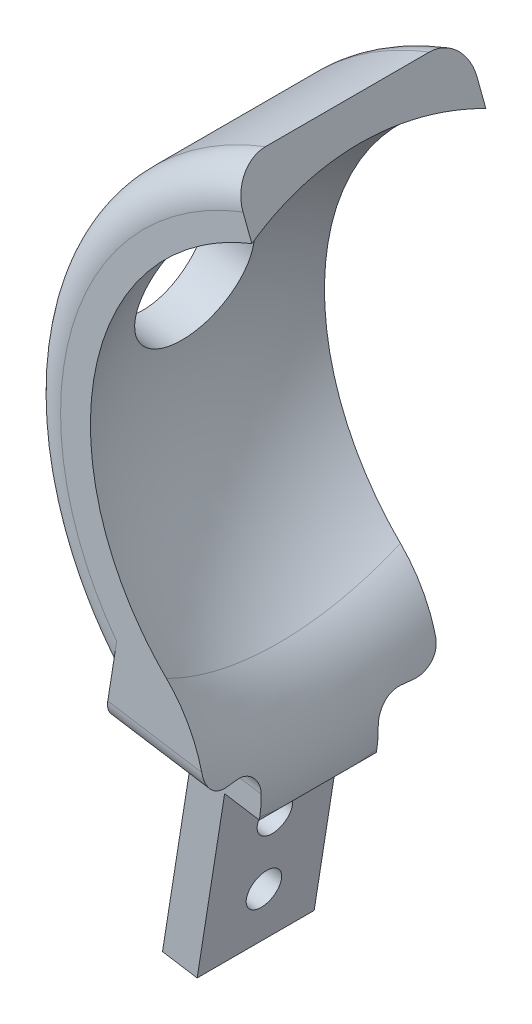
from build123d import *

# Parameters (mm, degrees)
SKETCH_1_R               = 13.75
EXTRUDE_1_DEPTH          = 10
CUT_EXTRUDE_1_DEPTH      = 22.866069606
PATTERN_CIRCULAR_1_COUNT = 20
EXTRUDE_2_DEPTH          = 5
EXTRUDE_2_DEPTH_BACK     = 15
CUT_EXTRUDE_3_DEPTH      = 10
CUT_EXTRUDE_3_DEPTH_BACK = 32
SKETCH_7_W               = 5
SKETCH_7_H               = 34
CUT_EXTRUDE_START        = -22
CUT_EXTRUDE_4_DEPTH      = 22
FILLET_2_R               = 2
FILLET_3_R               = 3
SKETCH_16_R              = 2
CUT_EXTRUDE_5_DEPTH      = 16.5
EXTRUDE_START            = 3.5
SKETCH_18_R              = 5
SKETCH_18_R_2            = 2
EXTRUDE_4_DEPTH          = 3.5
SKETCH_19_R              = 8
CUT_EXTRUDE_7_DEPTH      = 3
FILLET_4_R               = 2
CUT_EXTRUDE_8_DEPTH      = 10
CUT_EXTRUDE_9_DEPTH      = 22
SKETCH_22_R              = 1.5
CUT_EXTRUDE_10_DEPTH     = 22
SKETCH_24_R              = 5
CUT_EXTRUDE_11_DEPTH     = 26
FILLET_5_R               = 10


with BuildPart() as part:
    # 草图1 → 凸台-拉伸1 (new body)
    with BuildSketch(Plane.XY):
        Circle(SKETCH_1_R)
    extrude(amount=EXTRUDE_1_DEPTH)

    # 草图2 → 切除-拉伸1 (cut, through all)
    with BuildSketch(Plane.XY):
        with BuildLine():
            ThreePointArc((0.241645751, 10.934830295), (0, 10.9375), (-0.241645751, 10.934830295))
            add(Edge.make_bspline(
                [(-0.241645751, 10.934830295), (-0.763986756, 11.11684439), (-0.696355124, 11.483892124), (-0.766121321, 11.837511753), (-0.773615233, 11.871945767), (-0.782888612, 11.910793269), (-0.794115121, 11.953996045), (-0.807473925, 12.001489371), (-0.823140069, 12.053203535), (-0.841287339, 12.109063416), (-0.862087187, 12.168988684), (-0.885708875, 12.232893806), (-0.912319248, 12.300688126), (-0.942082628, 12.372275913), (-0.975160664, 12.447556439), (-1.011712206, 12.526424039), (-1.051893167, 12.608768189), (-1.095856396, 12.694473577), (-1.143751548, 12.783420187), (-1.195724957, 12.87548338), (-1.251919512, 12.970533976), (-1.312474533, 13.068438347), (-1.377525652, 13.169058507), (-1.447204695, 13.272252205), (-1.521639564, 13.377873025), (-1.600954126, 13.485770488), (-1.685268101, 13.595790151), (-1.774696952, 13.707773716), (-1.869351783, 13.821559139), (-1.969339231, 13.936980743), (-2.074761371, 14.053869328), (-2.185715611, 14.172052294), (-2.302294605, 14.291353753), (-2.424586158, 14.411594659), (-2.552673133, 14.532592924), (-2.686633373, 14.654163553), (-2.826539612, 14.776118764), (-2.972459398, 14.898268124), (-3.124455015, 15.020418683), (-3.282583418, 15.142375102), (-3.446896124, 15.2639398), (-3.676841988, 15.427049835), (-3.854915516, 15.545415751), (-3.976447477, 15.622814825)],
                knots=[0, 0, 0, 0, 0.165916003, 0.170905922, 0.176663519, 0.183188797, 0.190481754, 0.198542391, 0.207370708, 0.216966704, 0.22733038, 0.238461736, 0.250360771, 0.263027487, 0.276461881, 0.290663956, 0.30563371, 0.321371144, 0.337876258, 0.355149051, 0.373189524, 0.391997677, 0.411573509, 0.431917021, 0.453028213, 0.474907084, 0.497553636, 0.520967867, 0.545149777, 0.570099367, 0.595816637, 0.622301587, 0.649554216, 0.677574526, 0.706362514, 0.735918183, 0.766241531, 0.797332559, 0.829191267, 0.861817654, 0.895211721, 0.929373468, 1, 1, 1, 1], degree=3))
            ThreePointArc((-3.976447477, 15.622814825), (0, 16.120932901), (3.976447477, 15.622814825))
            add(Edge.make_bspline(
                [(0.241645751, 10.934830295), (0.763986756, 11.11684439), (0.696355124, 11.483892124), (0.766121321, 11.837511753), (0.773615233, 11.871945767), (0.782888612, 11.910793269), (0.794115121, 11.953996045), (0.807473925, 12.001489371), (0.823140069, 12.053203535), (0.841287339, 12.109063416), (0.862087187, 12.168988684), (0.885708875, 12.232893806), (0.912319248, 12.300688126), (0.942082628, 12.372275913), (0.975160664, 12.447556439), (1.011712206, 12.526424039), (1.051893167, 12.608768189), (1.095856396, 12.694473577), (1.143751548, 12.783420187), (1.195724957, 12.87548338), (1.251919512, 12.970533976), (1.312474533, 13.068438347), (1.377525652, 13.169058507), (1.447204695, 13.272252205), (1.521639564, 13.377873025), (1.600954126, 13.485770488), (1.685268101, 13.595790151), (1.774696952, 13.707773716), (1.869351783, 13.821559139), (1.969339231, 13.936980743), (2.074761371, 14.053869328), (2.185715611, 14.172052294), (2.302294605, 14.291353753), (2.424586158, 14.411594659), (2.552673133, 14.532592924), (2.686633373, 14.654163553), (2.826539612, 14.776118764), (2.972459398, 14.898268124), (3.124455015, 15.020418683), (3.282583418, 15.142375102), (3.446896124, 15.2639398), (3.676841988, 15.427049835), (3.854915516, 15.545415751), (3.976447477, 15.622814825)],
                knots=[0, 0, 0, 0, 0.165916003, 0.170905922, 0.176663519, 0.183188797, 0.190481754, 0.198542391, 0.207370708, 0.216966704, 0.22733038, 0.238461736, 0.250360771, 0.263027487, 0.276461881, 0.290663956, 0.30563371, 0.321371144, 0.337876258, 0.355149051, 0.373189524, 0.391997677, 0.411573509, 0.431917021, 0.453028213, 0.474907084, 0.497553636, 0.520967867, 0.545149777, 0.570099367, 0.595816637, 0.622301587, 0.649554216, 0.677574526, 0.706362514, 0.735918183, 0.766241531, 0.797332559, 0.829191267, 0.861817654, 0.895211721, 0.929373468, 1, 1, 1, 1], degree=3))
        make_face()
    cut_extrude_1 = extrude(amount=CUT_EXTRUDE_1_DEPTH, mode=Mode.SUBTRACT)

    # 阵列(圆周)1: 切除-拉伸1 ×20 about axis
    pattern_circular_1_axis = Axis((0, 0, -1.5), (0, 0, 1))
    for i in range(1, PATTERN_CIRCULAR_1_COUNT):
        add(cut_extrude_1.rotate(pattern_circular_1_axis, i * 360 / PATTERN_CIRCULAR_1_COUNT), mode=Mode.SUBTRACT)

    # 草图6 → 凸台-拉伸2 (add, two sides: drawn at the far end of the back side and taken through both)
    with BuildSketch(Plane(origin=(0, 0, 0), x_dir=(-1, 0, 0), z_dir=(0, 0, -1)).offset(-EXTRUDE_2_DEPTH_BACK)):
        with BuildLine():
            Line((-4.444597533, -0.703955093), (4.444597533, 0.703955093))
            Line((4.444597533, 0.703955093), (-1.123309149, 35.858334335))
            ThreePointArc((-1.123309149, 35.858334335), (6.18175463, 61.653569146), (-11.311209389, 81.969924763))
            Line((-11.311209389, 81.969924763), (-15.719831619, 70.4850712))
            Line((-15.719831619, 70.4850712), (-10.012504214, 34.45042415))
            Line((-10.012504214, 34.45042415), (-4.444597533, -0.703955093))
        make_face()
    extrude(amount=EXTRUDE_2_DEPTH + EXTRUDE_2_DEPTH_BACK)

    # 草图7 → 切除-拉伸3 (cut, two sides: drawn at the far end of the back side and taken through both)
    with BuildSketch(Plane(origin=(4.444597533, -0.703955093, 0), x_dir=(0, 0, -1), z_dir=(0.9876883405951378, -0.15643446504023126, 0)).offset(-CUT_EXTRUDE_3_DEPTH_BACK)):
        with Locations((2.5, 17)):
            Rectangle(SKETCH_7_W, SKETCH_7_H)
        with Locations((-12.5, 17)):
            Rectangle(SKETCH_7_W, SKETCH_7_H)
    extrude(amount=CUT_EXTRUDE_3_DEPTH + CUT_EXTRUDE_3_DEPTH_BACK, mode=Mode.SUBTRACT)

    # 草图13 → 切除-旋转2 (revolve, cut)
    with BuildSketch(Plane(origin=(12.346104257, -1.955430813, 0), x_dir=(0, 0, 1), z_dir=(-0.9876883405951388, 0.1564344650402244, 0))):
        with BuildLine():
            Line((5, 82.653118449), (5, 34.653118449))
            ThreePointArc((5, 34.653118449), (29, 58.653118449), (5, 82.653118449))
        make_face()
    revolve(axis=Axis((12.41385891, -1.527644771, 5), (0.1564344650402244, 0.9876883405951388, 0)), mode=Mode.SUBTRACT)

    # 草图12 → 切除-拉伸4 (cut)
    with BuildSketch(Plane(origin=(0, 0, -5), x_dir=(-1, 0, 0), z_dir=(0, 0, -1)).offset(CUT_EXTRUDE_START)):
        with BuildLine():
            Line((-11.311209389, 81.969924763), (-11.670273789, 81.03453002))
            ThreePointArc((-11.670273789, 81.03453002), (1.044926137, 71.010674644), (5.846281188, 55.547784376))
            ThreePointArc((5.846281188, 55.547784376), (3.991334875, 45.656412233), (-1.321428913, 37.109213298))
            Line((-1.321428913, 37.109213298), (-1.123309149, 35.858334335))
            ThreePointArc((-1.123309149, 35.858334335), (4.779753161, 44.926816989), (6.848224584, 55.547784376))
            ThreePointArc((6.848224584, 55.547784376), (1.87065393, 71.578181633), (-11.311209389, 81.969924763))
        make_face()
    extrude(amount=CUT_EXTRUDE_4_DEPTH, mode=Mode.SUBTRACT)

    # 圆角2
    fillet_2_edges = [part.edges().sort_by_distance(p)[0] for p in [
        (5.318771811, 33.58140358, 15),
        (5.318771811, 33.58140358, -5),
        (5.318771811, 33.58140358, 0),
        (5.318771811, 33.58140358, 10),
    ]]
    fillet(fillet_2_edges, radius=FILLET_2_R)

    # 圆角3
    fillet_3_edges = [part.edges().sort_by_distance(p)[0] for p in [
        (-5.118751176, 61.808282659, -5),
        (-5.118751176, 61.808282659, 15),
    ]]
    fillet(fillet_3_edges, radius=FILLET_3_R)

    # 草图16 → 切除-拉伸5 (cut)
    with BuildSketch(Plane.XY.offset(10)):
        Circle(SKETCH_16_R)
    extrude(amount=-CUT_EXTRUDE_5_DEPTH, mode=Mode.SUBTRACT)

    # 草图18 → 凸台-拉伸4 (add)
    with BuildSketch(Plane.XY.offset(10).offset(EXTRUDE_START)):
        Circle(SKETCH_18_R)
        Circle(SKETCH_18_R_2, mode=Mode.SUBTRACT)
    extrude(amount=-EXTRUDE_4_DEPTH)

    # 草图19 → 切除-拉伸7 (cut)
    with BuildSketch(Plane(origin=(0, 0, 0), x_dir=(-1, 0, 0), z_dir=(0, 0, -1))):
        Circle(SKETCH_19_R)
    extrude(amount=-CUT_EXTRUDE_7_DEPTH, mode=Mode.SUBTRACT)

    # 圆角4
    fillet_4_edges = [part.edges().sort_by_distance(p)[0] for p in [
        (-5, 0, 10),
    ]]
    fillet(fillet_4_edges, radius=FILLET_4_R)

    # 草图20 → 切除-拉伸8 (cut)
    with BuildSketch(Plane(origin=(0, 0, 0), x_dir=(-1, 0, 0), z_dir=(0, 0, -1))):
        with BuildLine():
            Line((5.774187452, 16.519950341), (3.608867158, 10.324968963))
            ThreePointArc((3.608867158, 10.324968963), (8.919105639, 6.330755157), (10.9375, 0))
            ThreePointArc((10.9375, 0), (10.936832553, -0.120830249), (10.934830295, -0.241645751))
            Line((10.934830295, -0.241645751), (17.498331559, -0.241645751))
            ThreePointArc((17.498331559, -0.241645751), (17.499582885, -0.120825755), (17.5, 0))
            ThreePointArc((17.5, 0), (14.270569022, 10.129208251), (5.774187452, 16.519950341))
        make_face()
    extrude(amount=-CUT_EXTRUDE_8_DEPTH, mode=Mode.SUBTRACT)

    # 草图21 → 切除-拉伸9 (cut)
    with BuildSketch(Plane(origin=(0, 0, 0), x_dir=(-1, 0, 0), z_dir=(0, 0, -1))):
        Polygon((-3.828049486, 14.580673411), (-0.864984465, 15.049976806), (-3.21150144, 29.865301915), (16.542265372, 32.993991216), (24.363988624, -16.390425814), (3.089937746, -19.759904455), (-18.106610022, -23.11710781), (-25.928333274, 26.267309219), (-6.174566462, 29.39599852), align=None)
    extrude(amount=-CUT_EXTRUDE_9_DEPTH, mode=Mode.SUBTRACT)

    # 草图22 → 切除-拉伸10 (cut)
    with BuildSketch(Plane(origin=(1.481532511, -0.234651698, 0), x_dir=(0, 0, -1), z_dir=(0.9876883405951379, -0.15643446504023095, 0))):
        with Locations(Location((-5, 25.5, 0), (0, 0, 90))):
            Circle(SKETCH_22_R)
        with Locations(Location((-5, 19.5, 0), (0, 0, 90))):
            Circle(SKETCH_22_R)
    extrude(amount=-CUT_EXTRUDE_10_DEPTH, mode=Mode.SUBTRACT)

    # 草图24 → 切除-拉伸11 (cut)
    with BuildSketch(Plane(origin=(0, 0, 0), x_dir=(0, 0, 1), z_dir=(-0.9876883405951388, 0.1564344650402244, 0))):
        with Locations(Location((5, 60.060474958, 0), (0, 0, 90))):
            Circle(SKETCH_24_R)
    extrude(amount=CUT_EXTRUDE_11_DEPTH, mode=Mode.SUBTRACT)

    # 圆角5
    # the kernel refuses this fillet: 10 mm, written as the material it takes off along each edge
    with BuildSketch(Plane(origin=(13.61996674, 57.227046138, 5), x_dir=(-0.06465125849803334, -0.4081919812676051, -0.910603932126063), z_dir=(0.1424498389856716, 0.8993928866609987, -0.41328014565975996))) as fillet_5_piece_1:
        with BuildLine():
            CenterArc((28.844410204, 10), FILLET_5_R, 211.965718751, 58.034281249)
            ThreePointArc((20.360760144, 4.705882353), (21.622492356, 2.414788732), (22.627416998, 0))
            Line((22.627416998, 0), (28.844410204, 0))
        make_face()
    revolve(axis=Axis((13.61996674, 57.227046138, 5), (-0.9876883405951378, 0.15643446504023112, 0)), revolution_arc=131.177888663, mode=Mode.SUBTRACT)


solid = part.part
